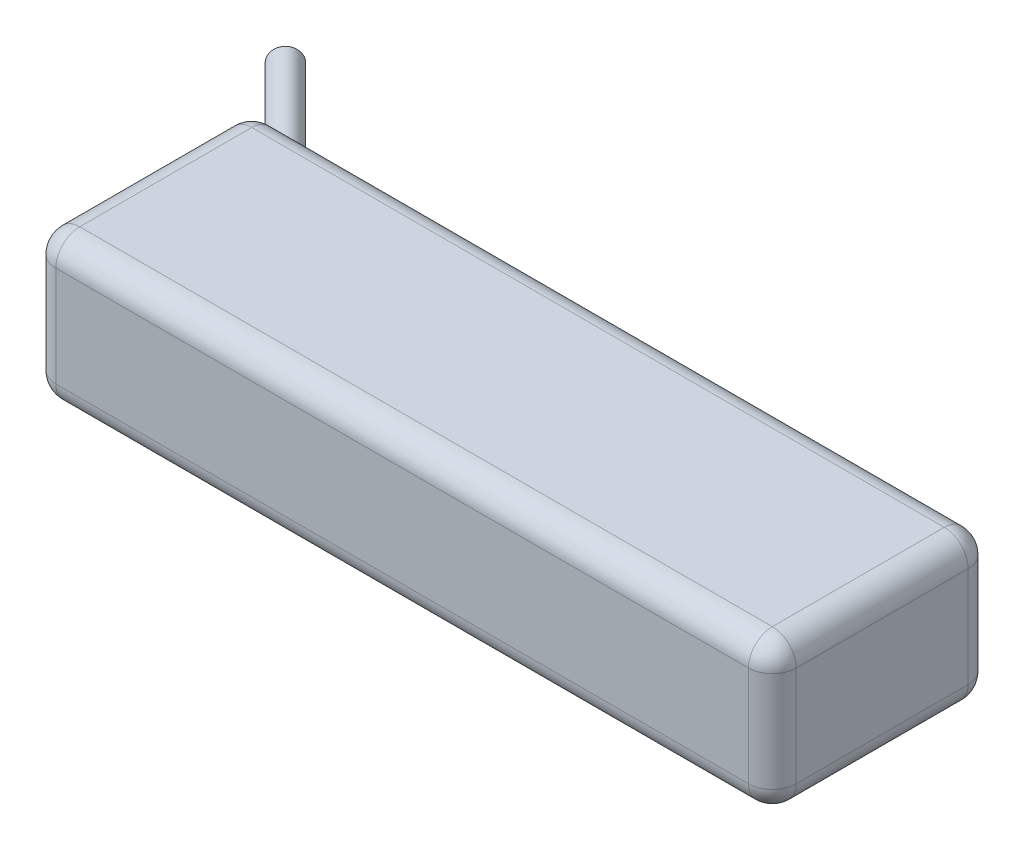
from build123d import *

# Parameters (mm, degrees)
SKETCH1_W           = 155
SKETCH1_H           = 46
BOSS_EXTRUDE1_DEPTH = 15.5
SKETCH4_R           = 3
BOSS_EXTRUDE2_DEPTH = 30
FILLET1_R           = 5


with BuildPart() as part:
    # Sketch1 → Boss-Extrude1 (new, symmetric)
    with BuildSketch(Plane(origin=(0, 0, 0), x_dir=(1, 0, 0), z_dir=(0, 1, 0))):
        Rectangle(SKETCH1_W, SKETCH1_H)
    extrude(amount=BOSS_EXTRUDE1_DEPTH, both=True)

    # Sketch4 → Boss-Extrude2 (add)
    with BuildSketch(Plane(origin=(-45.25, 0, -45.25), x_dir=(0.7071067811865509, 0, -0.7071067811865442), z_dir=(0.7071067811865442, 0, 0.7071067811865509))):
        with Locations((-33.537319575, 6)):
            Circle(SKETCH4_R)
        with Locations((-33.537319575, -6)):
            Circle(SKETCH4_R)
    extrude(amount=-BOSS_EXTRUDE2_DEPTH)

    # Fillet1
    # the kernel refuses this fillet: 5 mm, written as the material it takes off along each edge
    with BuildSketch(Plane(origin=(-72.5, 10.5, 18), x_dir=(0, 1, 0), z_dir=(-1, 0, 0))) as fillet1_piece_1_section:
        Polygon((0, 0), (FILLET1_R, 0), (FILLET1_R, -FILLET1_R), (0, -FILLET1_R), align=None)
    fillet1_piece_1 = extrude(amount=FILLET1_R, mode=Mode.PRIVATE)
    fillet1_piece_1 = fillet1_piece_1 - Plane(origin=(-72.5, 10.5, 18), x_dir=(0, -0.7071067811865475, -0.7071067811865475), z_dir=(-1, 0, 0)) * Sphere(FILLET1_R, mode=Mode.PRIVATE)
    add(fillet1_piece_1, mode=Mode.SUBTRACT)
    with BuildSketch(Plane(origin=(-72.5, 10.5, -18), x_dir=(-1, 0, 0), z_dir=(0, 0, -1))) as fillet1_piece_2_section:
        Polygon((0, 0), (FILLET1_R, 0), (FILLET1_R, FILLET1_R), (0, FILLET1_R), align=None)
    fillet1_piece_2 = extrude(amount=FILLET1_R, mode=Mode.PRIVATE)
    fillet1_piece_2 = fillet1_piece_2 - Plane(origin=(-72.5, 10.5, -18), x_dir=(0.7071067811865475, -0.7071067811865475, 0), z_dir=(0, 0, -1)) * Sphere(FILLET1_R, mode=Mode.PRIVATE)
    add(fillet1_piece_2, mode=Mode.SUBTRACT)
    with BuildSketch(Plane(origin=(72.5, 10.5, 18), x_dir=(0, 1, 0), z_dir=(0, 0, 1))) as fillet1_piece_3_section:
        Polygon((0, 0), (FILLET1_R, 0), (FILLET1_R, -FILLET1_R), (0, -FILLET1_R), align=None)
    fillet1_piece_3 = extrude(amount=FILLET1_R, mode=Mode.PRIVATE)
    fillet1_piece_3 = fillet1_piece_3 - Plane(origin=(72.5, 10.5, 18), x_dir=(-0.7071067811865475, -0.7071067811865475, 0), z_dir=(0, 0, 1)) * Sphere(FILLET1_R, mode=Mode.PRIVATE)
    add(fillet1_piece_3, mode=Mode.SUBTRACT)
    with BuildSketch(Plane(origin=(72.5, 10.5, -18), x_dir=(0, 1, 0), z_dir=(0, 0, -1))) as fillet1_piece_4_section:
        Polygon((0, 0), (FILLET1_R, 0), (FILLET1_R, FILLET1_R), (0, FILLET1_R), align=None)
    fillet1_piece_4 = extrude(amount=FILLET1_R, mode=Mode.PRIVATE)
    fillet1_piece_4 = fillet1_piece_4 - Plane(origin=(72.5, 10.5, -18), x_dir=(-0.7071067811865475, -0.7071067811865475, 0), z_dir=(0, 0, -1)) * Sphere(FILLET1_R, mode=Mode.PRIVATE)
    add(fillet1_piece_4, mode=Mode.SUBTRACT)
    with BuildSketch(Plane(origin=(72.5, -10.5, 18), x_dir=(0, -1, 0), z_dir=(0, 0, 1))) as fillet1_piece_5_section:
        Polygon((0, 0), (FILLET1_R, 0), (FILLET1_R, FILLET1_R), (0, FILLET1_R), align=None)
    fillet1_piece_5 = extrude(amount=FILLET1_R, mode=Mode.PRIVATE)
    fillet1_piece_5 = fillet1_piece_5 - Plane(origin=(72.5, -10.5, 18), x_dir=(-0.7071067811865475, 0.7071067811865475, 0), z_dir=(0, 0, 1)) * Sphere(FILLET1_R, mode=Mode.PRIVATE)
    add(fillet1_piece_5, mode=Mode.SUBTRACT)
    with BuildSketch(Plane(origin=(-72.5, -10.5, 18), x_dir=(0, -1, 0), z_dir=(0, 0, 1))) as fillet1_piece_6_section:
        Polygon((0, 0), (FILLET1_R, 0), (FILLET1_R, -FILLET1_R), (0, -FILLET1_R), align=None)
    fillet1_piece_6 = extrude(amount=FILLET1_R, mode=Mode.PRIVATE)
    fillet1_piece_6 = fillet1_piece_6 - Plane(origin=(-72.5, -10.5, 18), x_dir=(0.7071067811865475, 0.7071067811865475, 0), z_dir=(0, 0, 1)) * Sphere(FILLET1_R, mode=Mode.PRIVATE)
    add(fillet1_piece_6, mode=Mode.SUBTRACT)
    with BuildSketch(Plane(origin=(-72.5, -10.5, -18), x_dir=(-1, 0, 0), z_dir=(0, 0, -1))) as fillet1_piece_7_section:
        Polygon((0, 0), (FILLET1_R, 0), (FILLET1_R, -FILLET1_R), (0, -FILLET1_R), align=None)
    fillet1_piece_7 = extrude(amount=FILLET1_R, mode=Mode.PRIVATE)
    fillet1_piece_7 = fillet1_piece_7 - Plane(origin=(-72.5, -10.5, -18), x_dir=(0.7071067811865475, 0.7071067811865475, 0), z_dir=(0, 0, -1)) * Sphere(FILLET1_R, mode=Mode.PRIVATE)
    add(fillet1_piece_7, mode=Mode.SUBTRACT)
    with BuildSketch(Plane(origin=(72.5, -10.5, -18), x_dir=(0, -1, 0), z_dir=(0, 0, -1))) as fillet1_piece_8_section:
        Polygon((0, 0), (FILLET1_R, 0), (FILLET1_R, -FILLET1_R), (0, -FILLET1_R), align=None)
    fillet1_piece_8 = extrude(amount=FILLET1_R, mode=Mode.PRIVATE)
    fillet1_piece_8 = fillet1_piece_8 - Plane(origin=(72.5, -10.5, -18), x_dir=(-0.7071067811865475, 0.7071067811865475, 0), z_dir=(0, 0, -1)) * Sphere(FILLET1_R, mode=Mode.PRIVATE)
    add(fillet1_piece_8, mode=Mode.SUBTRACT)
    with BuildSketch(Plane(origin=(-77.5, 15.5, 18), x_dir=(0, -1, 0), z_dir=(0, 0, -1)), Plane(origin=(77.5, -15.5, -18), x_dir=(-1, 0, 0), z_dir=(0, 0, 1))) as fillet1_piece_9:
        with BuildLine():
            CenterArc((FILLET1_R, -FILLET1_R), FILLET1_R, 90, 90)
            Line((0, -FILLET1_R), (0, 0))
            Line((0, 0), (FILLET1_R, 0))
        make_face()
    extrude(amount=36, mode=Mode.SUBTRACT)
    with BuildSketch(Plane(origin=(72.5, 15.5, 23), x_dir=(0, 0, -1), z_dir=(-1, 0, 0)), Plane(origin=(-72.5, -15.5, -23), x_dir=(0, 1, 0), z_dir=(1, 0, 0))) as fillet1_piece_10:
        with BuildLine():
            CenterArc((FILLET1_R, FILLET1_R), FILLET1_R, 180, 90)
            Line((0, FILLET1_R), (0, 0))
            Line((0, 0), (FILLET1_R, 0))
        make_face()
    extrude(amount=145, mode=Mode.SUBTRACT)
    with BuildSketch(Plane(origin=(77.5, 15.5, -18), x_dir=(-1, 0, 0), z_dir=(0, 0, 1)), Plane(origin=(-77.5, -15.5, 18), x_dir=(0, 1, 0), z_dir=(0, 0, -1))) as fillet1_piece_11:
        with BuildLine():
            CenterArc((FILLET1_R, FILLET1_R), FILLET1_R, 180, 90)
            Line((0, FILLET1_R), (0, 0))
            Line((0, 0), (FILLET1_R, 0))
        make_face()
    extrude(amount=36, mode=Mode.SUBTRACT)
    with BuildSketch(Plane(origin=(72.5, -15.5, 23), x_dir=(0, 0, -1), z_dir=(-1, 0, 0)), Plane(origin=(-72.5, 15.5, -23), x_dir=(0, -1, 0), z_dir=(1, 0, 0))) as fillet1_piece_12:
        with BuildLine():
            CenterArc((FILLET1_R, -FILLET1_R), FILLET1_R, 90, 90)
            Line((0, -FILLET1_R), (0, 0))
            Line((0, 0), (FILLET1_R, 0))
        make_face()
    extrude(amount=145, mode=Mode.SUBTRACT)
    with BuildSketch(Plane(origin=(77.5, 10.5, 23), x_dir=(0, 0, -1), z_dir=(0, -1, 0)), Plane(origin=(-77.5, -10.5, 23), x_dir=(0, 0, -1), z_dir=(0, 1, 0)), Plane(origin=(77.5, 10.5, -23), x_dir=(-1, 0, 0), z_dir=(0, -1, 0))) as fillet1_piece_13:
        with BuildLine():
            CenterArc((FILLET1_R, -FILLET1_R), FILLET1_R, 90, 90)
            Line((0, -FILLET1_R), (0, 0))
            Line((0, 0), (FILLET1_R, 0))
        make_face()
    extrude(amount=21, mode=Mode.SUBTRACT)
    with BuildSketch(Plane(origin=(-77.5, -10.5, -23), x_dir=(1, 0, 0), z_dir=(0, 1, 0))) as fillet1_piece_14_section:
        with BuildLine():
            CenterArc((FILLET1_R, -FILLET1_R), FILLET1_R, 90, 90)
            Line((0, -FILLET1_R), (0, 0))
            Line((0, 0), (FILLET1_R, 0))
        make_face()
    fillet1_piece_14 = extrude(amount=21, mode=Mode.PRIVATE)
    fillet1_piece_14 = fillet1_piece_14 - Plane(origin=(-72.851968895, -6, -25.423036706), x_dir=(0.7071067811865509, 0, -0.7071067811865442), z_dir=(0.7071067811865442, 0, 0.7071067811865509)) * Cylinder(3, 62, mode=Mode.PRIVATE)
    fillet1_piece_14 = fillet1_piece_14 - Plane(origin=(-72.851968895, 6, -25.423036706), x_dir=(0.7071067811865509, 0, -0.7071067811865442), z_dir=(0.7071067811865442, 0, 0.7071067811865509)) * Cylinder(3, 62, mode=Mode.PRIVATE)
    add(fillet1_piece_14, mode=Mode.SUBTRACT)


solid = part.part
